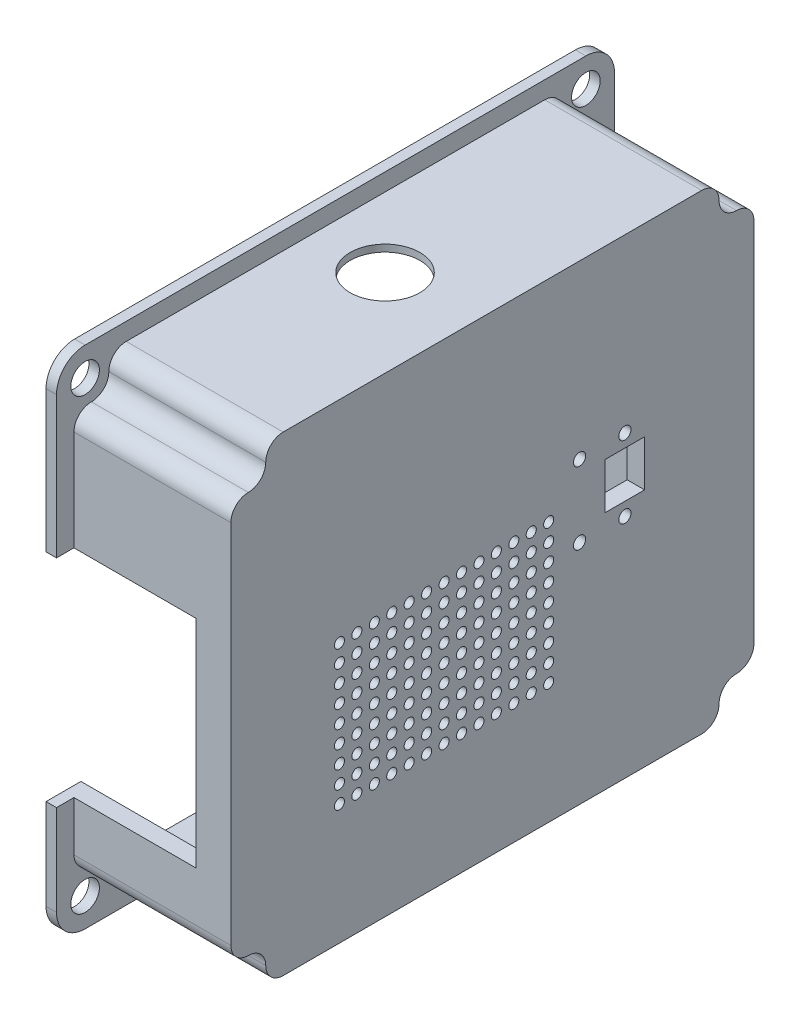
from build123d import *

# Parameters (mm, degrees)
SALIENTE_EXTRUIR1_DEPTH      = 3
SALIENTE_EXTRUIR2_DEPTH      = 40
SALIENTE_EXTRUIR2_DEPTH_BACK = 3
CROQUIS4_R                   = 4.1
CORTAR_EXTRUIR1_DEPTH        = 10
REDONDEO1_R                  = 5
CROQUIS5_R                   = 1.45
SALIENTE_EXTRUIR3_DEPTH      = 5
CORTAR_EXTRUIR2_DEPTH        = 7
CORTAR_EXTRUIR2_DEPTH_BACK   = 7
CROQUIS6_W                   = 38
CROQUIS6_H                   = 62
CORTAR_EXTRUIR3_REACH        = 170.238
CROQUIS7_R                   = 10
CROQUIS8_R                   = 14
CORTAR_EXTRUIR4_DEPTH        = 3
REDONDEO2_R                  = 2
CORTAR_EXTRUIR5_START        = -3
CROQUIS9_R                   = 14
CORTAR_EXTRUIR5_DEPTH        = 3
REDONDEO3_R                  = 2
CROQUIS10_R                  = 1.75
CROQUIS10_W                  = 13.2
CROQUIS10_H                  = 11.37393079
CORTAR_EXTRUIR6_DEPTH        = 10


with BuildPart() as part:
    # Croquis2 → Saliente-Extruir1 (new body)
    with BuildSketch(Plane.YZ):
        with BuildLine():
            Line((-64.3, 80), (64.3, 80))
            ThreePointArc((64.3, 80), (70.098275606, 77.598275606), (72.5, 71.8))
            Line((72.5, 71.8), (72.5, -71.8))
            ThreePointArc((72.5, -71.8), (70.098275606, -77.598275606), (64.3, -80))
            Line((64.3, -80), (-64.3, -80))
            ThreePointArc((-64.3, -80), (-70.098275606, -77.598275606), (-72.5, -71.8))
            Line((-72.5, -71.8), (-72.5, 71.8))
            ThreePointArc((-72.5, 71.8), (-70.098275606, 77.598275606), (-64.3, 80))
        make_face()
        Polygon((57.5, 75), (57.5, 65), (67.5, 65), (67.5, -65), (57.5, -65), (57.5, -75), (-57.5, -75), (-57.5, -65), (-67.5, -65), (-67.5, 65), (-57.5, 65), (-57.5, 75), align=None, mode=Mode.SUBTRACT)
    extrude(amount=SALIENTE_EXTRUIR1_DEPTH)

    # Croquis3 → Saliente-Extruir2 (add, two sides: drawn at the far end of the back side and taken through both)
    with BuildSketch(Plane.YZ.offset(3).offset(-SALIENTE_EXTRUIR2_DEPTH_BACK)):
        Polygon((-57.5, -65), (-57.5, -75), (57.5, -75), (57.5, -65), (67.5, -65), (67.5, 65), (57.5, 65), (57.5, 75), (-57.5, 75), (-57.5, 65), (-67.5, 65), (-67.5, -65), align=None)
        Polygon((-52.5, -60), (-52.5, -70), (52.5, -70), (52.5, -60), (62.5, -60), (62.5, 60), (52.5, 60), (52.5, 70), (-52.5, 70), (-52.5, 60), (-62.5, 60), (-62.5, -60), align=None, mode=Mode.SUBTRACT)
    extrude(amount=SALIENTE_EXTRUIR2_DEPTH + SALIENTE_EXTRUIR2_DEPTH_BACK)

    # Croquis4 → Cortar-Extruir1 (cut)
    with BuildSketch(Plane.YZ.offset(3)):
        with Locations(Location((64.3, -71.8, 0), (0, 0, 270))):
            Circle(CROQUIS4_R)
        with Locations(Location((64.3, 71.8, 0), (0, 0, 270))):
            Circle(CROQUIS4_R)
        with Locations(Location((-64.3, 71.8, 0), (0, 0, 270))):
            Circle(CROQUIS4_R)
        with Locations(Location((-64.3, -71.8, 0), (0, 0, 270))):
            Circle(CROQUIS4_R)
    extrude(amount=-CORTAR_EXTRUIR1_DEPTH, mode=Mode.SUBTRACT)

    # Redondeo1
    redondeo1_edges = [part.edges().sort_by_distance(p)[0] for p in [
        (23, 57.5, 75),
        (23, 57.5, 65),
        (23, 67.5, 65),
        (21.5, -52.5, -60),
        (21.5, -52.5, -70),
        (21.5, 52.5, -70),
        (21.5, 52.5, -60),
        (21.5, 62.5, -60),
        (21.5, -52.5, 70),
        (21.5, -52.5, 60),
        (21.5, -62.5, 60),
        (21.5, -62.5, -60),
        (23, -67.5, -65),
        (23, -67.5, 65),
        (23, -57.5, 65),
        (23, 67.5, -65),
        (23, 57.5, -65),
        (23, 57.5, -75),
        (23, -57.5, -75),
        (23, -57.5, -65),
        (23, -57.5, 75),
        (21.5, 52.5, 70),
        (21.5, 62.5, 60),
        (21.5, 52.5, 60),
    ]]
    fillet(redondeo1_edges, radius=REDONDEO1_R - 0.0001)  # a hair under: the kernel refuses the full size

    # Croquis5 → Saliente-Extruir3 (add)
    with BuildSketch(Plane.YZ.offset(43)):
        with BuildLine():
            Line((-67.5, 60), (-67.5, -60))
            ThreePointArc((-67.5, -60), (-66.035533906, -63.535533906), (-62.5, -65))
            ThreePointArc((-62.5, -65), (-58.964466094, -66.464466094), (-57.5, -70))
            ThreePointArc((-57.5, -70), (-56.035533906, -73.535533906), (-52.5, -75))
            Line((-52.5, -75), (52.5, -75))
            ThreePointArc((52.5, -75), (56.035533906, -73.535533906), (57.5, -70))
            ThreePointArc((57.5, -70), (58.964466094, -66.464466094), (62.5, -65))
            ThreePointArc((62.5, -65), (66.035533906, -63.535533906), (67.5, -60))
            Line((67.5, -60), (67.5, 60))
            ThreePointArc((67.5, 60), (66.035533906, 63.535533906), (62.5, 65))
            ThreePointArc((62.5, 65), (58.964466094, 66.464466094), (57.5, 70))
            ThreePointArc((57.5, 70), (56.035533906, 73.535533906), (52.5, 75))
            Line((52.5, 75), (-52.5, 75))
            ThreePointArc((-52.5, 75), (-56.035533906, 73.535533906), (-57.5, 70))
            ThreePointArc((-57.5, 70), (-58.964466094, 66.464466094), (-62.5, 65))
            ThreePointArc((-62.5, 65), (-66.035533906, 63.535533906), (-67.5, 60))
        make_face()
        with Locations(Location((7.073344347, -16.136194388, 0), (0, 0, 270))):
            Circle(CROQUIS5_R, mode=Mode.SUBTRACT)
        with Locations(Location((2.073344347, -16.136194388, 0), (0, 0, 270))):
            Circle(CROQUIS5_R, mode=Mode.SUBTRACT)
        with Locations(Location((-2.926655653, -16.136194388, 0), (0, 0, 270))):
            Circle(CROQUIS5_R, mode=Mode.SUBTRACT)
        with Locations(Location((-7.926655653, -16.136194388, 0), (0, 0, 270))):
            Circle(CROQUIS5_R, mode=Mode.SUBTRACT)
        with Locations(Location((-12.926655653, -16.136194388, 0), (0, 0, 270))):
            Circle(CROQUIS5_R, mode=Mode.SUBTRACT)
        with Locations(Location((-17.926655653, -16.136194388, 0), (0, 0, 270))):
            Circle(CROQUIS5_R, mode=Mode.SUBTRACT)
        with Locations(Location((-22.926655653, -16.136194388, 0), (0, 0, 270))):
            Circle(CROQUIS5_R, mode=Mode.SUBTRACT)
        with Locations(Location((-27.926655653, -16.136194388, 0), (0, 0, 270))):
            Circle(CROQUIS5_R, mode=Mode.SUBTRACT)
        with Locations(Location((-32.926655653, -16.136194388, 0), (0, 0, 270))):
            Circle(CROQUIS5_R, mode=Mode.SUBTRACT)
        with Locations(Location((2.073344347, -11.136194388, 0), (0, 0, 270))):
            Circle(CROQUIS5_R, mode=Mode.SUBTRACT)
        with Locations(Location((-2.926655653, -11.136194388, 0), (0, 0, 270))):
            Circle(CROQUIS5_R, mode=Mode.SUBTRACT)
        with Locations(Location((-7.926655653, -11.136194388, 0), (0, 0, 270))):
            Circle(CROQUIS5_R, mode=Mode.SUBTRACT)
        with Locations(Location((-12.926655653, -11.136194388, 0), (0, 0, 270))):
            Circle(CROQUIS5_R, mode=Mode.SUBTRACT)
        with Locations(Location((-17.926655653, -11.136194388, 0), (0, 0, 270))):
            Circle(CROQUIS5_R, mode=Mode.SUBTRACT)
        with Locations(Location((-22.926655653, -11.136194388, 0), (0, 0, 270))):
            Circle(CROQUIS5_R, mode=Mode.SUBTRACT)
        with Locations(Location((-27.926655653, -11.136194388, 0), (0, 0, 270))):
            Circle(CROQUIS5_R, mode=Mode.SUBTRACT)
        with Locations(Location((-32.926655653, -11.136194388, 0), (0, 0, 270))):
            Circle(CROQUIS5_R, mode=Mode.SUBTRACT)
        with Locations(Location((2.073344347, -6.136194388, 0), (0, 0, 270))):
            Circle(CROQUIS5_R, mode=Mode.SUBTRACT)
        with Locations(Location((-2.926655653, -6.136194388, 0), (0, 0, 270))):
            Circle(CROQUIS5_R, mode=Mode.SUBTRACT)
        with Locations(Location((-7.926655653, -6.136194388, 0), (0, 0, 270))):
            Circle(CROQUIS5_R, mode=Mode.SUBTRACT)
        with Locations(Location((-12.926655653, -6.136194388, 0), (0, 0, 270))):
            Circle(CROQUIS5_R, mode=Mode.SUBTRACT)
        with Locations(Location((-17.926655653, -6.136194388, 0), (0, 0, 270))):
            Circle(CROQUIS5_R, mode=Mode.SUBTRACT)
        with Locations(Location((-22.926655653, -6.136194388, 0), (0, 0, 270))):
            Circle(CROQUIS5_R, mode=Mode.SUBTRACT)
        with Locations(Location((-27.926655653, -6.136194388, 0), (0, 0, 270))):
            Circle(CROQUIS5_R, mode=Mode.SUBTRACT)
        with Locations(Location((-32.926655653, -6.136194388, 0), (0, 0, 270))):
            Circle(CROQUIS5_R, mode=Mode.SUBTRACT)
        with Locations(Location((2.073344347, -1.136194388, 0), (0, 0, 270))):
            Circle(CROQUIS5_R, mode=Mode.SUBTRACT)
        with Locations(Location((-2.926655653, -1.136194388, 0), (0, 0, 270))):
            Circle(CROQUIS5_R, mode=Mode.SUBTRACT)
        with Locations(Location((-7.926655653, -1.136194388, 0), (0, 0, 270))):
            Circle(CROQUIS5_R, mode=Mode.SUBTRACT)
        with Locations(Location((-12.926655653, -1.136194388, 0), (0, 0, 270))):
            Circle(CROQUIS5_R, mode=Mode.SUBTRACT)
        with Locations(Location((-17.926655653, -1.136194388, 0), (0, 0, 270))):
            Circle(CROQUIS5_R, mode=Mode.SUBTRACT)
        with Locations(Location((-22.926655653, -1.136194388, 0), (0, 0, 270))):
            Circle(CROQUIS5_R, mode=Mode.SUBTRACT)
        with Locations(Location((-27.926655653, -1.136194388, 0), (0, 0, 270))):
            Circle(CROQUIS5_R, mode=Mode.SUBTRACT)
        with Locations(Location((-32.926655653, -1.136194388, 0), (0, 0, 270))):
            Circle(CROQUIS5_R, mode=Mode.SUBTRACT)
        with Locations(Location((2.073344347, 3.863805612, 0), (0, 0, 270))):
            Circle(CROQUIS5_R, mode=Mode.SUBTRACT)
        with Locations(Location((-2.926655653, 3.863805612, 0), (0, 0, 270))):
            Circle(CROQUIS5_R, mode=Mode.SUBTRACT)
        with Locations(Location((-7.926655653, 3.863805612, 0), (0, 0, 270))):
            Circle(CROQUIS5_R, mode=Mode.SUBTRACT)
        with Locations(Location((-12.926655653, 3.863805612, 0), (0, 0, 270))):
            Circle(CROQUIS5_R, mode=Mode.SUBTRACT)
        with Locations(Location((-17.926655653, 3.863805612, 0), (0, 0, 270))):
            Circle(CROQUIS5_R, mode=Mode.SUBTRACT)
        with Locations(Location((-22.926655653, 3.863805612, 0), (0, 0, 270))):
            Circle(CROQUIS5_R, mode=Mode.SUBTRACT)
        with Locations(Location((-27.926655653, 3.863805612, 0), (0, 0, 270))):
            Circle(CROQUIS5_R, mode=Mode.SUBTRACT)
        with Locations(Location((-32.926655653, 3.863805612, 0), (0, 0, 270))):
            Circle(CROQUIS5_R, mode=Mode.SUBTRACT)
        with Locations(Location((2.073344347, 8.863805612, 0), (0, 0, 270))):
            Circle(CROQUIS5_R, mode=Mode.SUBTRACT)
        with Locations(Location((-2.926655653, 8.863805612, 0), (0, 0, 270))):
            Circle(CROQUIS5_R, mode=Mode.SUBTRACT)
        with Locations(Location((-7.926655653, 8.863805612, 0), (0, 0, 270))):
            Circle(CROQUIS5_R, mode=Mode.SUBTRACT)
        with Locations(Location((-12.926655653, 8.863805612, 0), (0, 0, 270))):
            Circle(CROQUIS5_R, mode=Mode.SUBTRACT)
        with Locations(Location((-17.926655653, 8.863805612, 0), (0, 0, 270))):
            Circle(CROQUIS5_R, mode=Mode.SUBTRACT)
        with Locations(Location((-22.926655653, 8.863805612, 0), (0, 0, 270))):
            Circle(CROQUIS5_R, mode=Mode.SUBTRACT)
        with Locations(Location((-27.926655653, 8.863805612, 0), (0, 0, 270))):
            Circle(CROQUIS5_R, mode=Mode.SUBTRACT)
        with Locations(Location((-32.926655653, 8.863805612, 0), (0, 0, 270))):
            Circle(CROQUIS5_R, mode=Mode.SUBTRACT)
        with Locations(Location((2.073344347, 13.863805612, 0), (0, 0, 270))):
            Circle(CROQUIS5_R, mode=Mode.SUBTRACT)
        with Locations(Location((-2.926655653, 13.863805612, 0), (0, 0, 270))):
            Circle(CROQUIS5_R, mode=Mode.SUBTRACT)
        with Locations(Location((-7.926655653, 13.863805612, 0), (0, 0, 270))):
            Circle(CROQUIS5_R, mode=Mode.SUBTRACT)
        with Locations(Location((-12.926655653, 13.863805612, 0), (0, 0, 270))):
            Circle(CROQUIS5_R, mode=Mode.SUBTRACT)
        with Locations(Location((-17.926655653, 13.863805612, 0), (0, 0, 270))):
            Circle(CROQUIS5_R, mode=Mode.SUBTRACT)
        with Locations(Location((-22.926655653, 13.863805612, 0), (0, 0, 270))):
            Circle(CROQUIS5_R, mode=Mode.SUBTRACT)
        with Locations(Location((-27.926655653, 13.863805612, 0), (0, 0, 270))):
            Circle(CROQUIS5_R, mode=Mode.SUBTRACT)
        with Locations(Location((-32.926655653, 13.863805612, 0), (0, 0, 270))):
            Circle(CROQUIS5_R, mode=Mode.SUBTRACT)
        with Locations(Location((2.073344347, 18.863805612, 0), (0, 0, 270))):
            Circle(CROQUIS5_R, mode=Mode.SUBTRACT)
        with Locations(Location((-2.926655653, 18.863805612, 0), (0, 0, 270))):
            Circle(CROQUIS5_R, mode=Mode.SUBTRACT)
        with Locations(Location((-7.926655653, 18.863805612, 0), (0, 0, 270))):
            Circle(CROQUIS5_R, mode=Mode.SUBTRACT)
        with Locations(Location((-12.926655653, 18.863805612, 0), (0, 0, 270))):
            Circle(CROQUIS5_R, mode=Mode.SUBTRACT)
        with Locations(Location((-17.926655653, 18.863805612, 0), (0, 0, 270))):
            Circle(CROQUIS5_R, mode=Mode.SUBTRACT)
        with Locations(Location((-22.926655653, 18.863805612, 0), (0, 0, 270))):
            Circle(CROQUIS5_R, mode=Mode.SUBTRACT)
        with Locations(Location((-27.926655653, 18.863805612, 0), (0, 0, 270))):
            Circle(CROQUIS5_R, mode=Mode.SUBTRACT)
        with Locations(Location((-32.926655653, 18.863805612, 0), (0, 0, 270))):
            Circle(CROQUIS5_R, mode=Mode.SUBTRACT)
        with Locations(Location((2.073344347, 23.863805612, 0), (0, 0, 270))):
            Circle(CROQUIS5_R, mode=Mode.SUBTRACT)
        with Locations(Location((-2.926655653, 23.863805612, 0), (0, 0, 270))):
            Circle(CROQUIS5_R, mode=Mode.SUBTRACT)
        with Locations(Location((-7.926655653, 23.863805612, 0), (0, 0, 270))):
            Circle(CROQUIS5_R, mode=Mode.SUBTRACT)
        with Locations(Location((-12.926655653, 23.863805612, 0), (0, 0, 270))):
            Circle(CROQUIS5_R, mode=Mode.SUBTRACT)
        with Locations(Location((-17.926655653, 23.863805612, 0), (0, 0, 270))):
            Circle(CROQUIS5_R, mode=Mode.SUBTRACT)
        with Locations(Location((-22.926655653, 23.863805612, 0), (0, 0, 270))):
            Circle(CROQUIS5_R, mode=Mode.SUBTRACT)
        with Locations(Location((-27.926655653, 23.863805612, 0), (0, 0, 270))):
            Circle(CROQUIS5_R, mode=Mode.SUBTRACT)
        with Locations(Location((-32.926655653, 23.863805612, 0), (0, 0, 270))):
            Circle(CROQUIS5_R, mode=Mode.SUBTRACT)
        with Locations(Location((2.073344347, 28.863805612, 0), (0, 0, 270))):
            Circle(CROQUIS5_R, mode=Mode.SUBTRACT)
        with Locations(Location((-2.926655653, 28.863805612, 0), (0, 0, 270))):
            Circle(CROQUIS5_R, mode=Mode.SUBTRACT)
        with Locations(Location((-7.926655653, 28.863805612, 0), (0, 0, 270))):
            Circle(CROQUIS5_R, mode=Mode.SUBTRACT)
        with Locations(Location((-12.926655653, 28.863805612, 0), (0, 0, 270))):
            Circle(CROQUIS5_R, mode=Mode.SUBTRACT)
        with Locations(Location((-17.926655653, 28.863805612, 0), (0, 0, 270))):
            Circle(CROQUIS5_R, mode=Mode.SUBTRACT)
        with Locations(Location((-22.926655653, 28.863805612, 0), (0, 0, 270))):
            Circle(CROQUIS5_R, mode=Mode.SUBTRACT)
        with Locations(Location((-27.926655653, 28.863805612, 0), (0, 0, 270))):
            Circle(CROQUIS5_R, mode=Mode.SUBTRACT)
        with Locations(Location((-32.926655653, 28.863805612, 0), (0, 0, 270))):
            Circle(CROQUIS5_R, mode=Mode.SUBTRACT)
        with Locations(Location((2.073344347, 33.863805612, 0), (0, 0, 270))):
            Circle(CROQUIS5_R, mode=Mode.SUBTRACT)
        with Locations(Location((-2.926655653, 33.863805612, 0), (0, 0, 270))):
            Circle(CROQUIS5_R, mode=Mode.SUBTRACT)
        with Locations(Location((-7.926655653, 33.863805612, 0), (0, 0, 270))):
            Circle(CROQUIS5_R, mode=Mode.SUBTRACT)
        with Locations(Location((-12.926655653, 33.863805612, 0), (0, 0, 270))):
            Circle(CROQUIS5_R, mode=Mode.SUBTRACT)
        with Locations(Location((-17.926655653, 33.863805612, 0), (0, 0, 270))):
            Circle(CROQUIS5_R, mode=Mode.SUBTRACT)
        with Locations(Location((-22.926655653, 33.863805612, 0), (0, 0, 270))):
            Circle(CROQUIS5_R, mode=Mode.SUBTRACT)
        with Locations(Location((-27.926655653, 33.863805612, 0), (0, 0, 270))):
            Circle(CROQUIS5_R, mode=Mode.SUBTRACT)
        with Locations(Location((-32.926655653, 33.863805612, 0), (0, 0, 270))):
            Circle(CROQUIS5_R, mode=Mode.SUBTRACT)
        with Locations(Location((2.073344347, 38.863805612, 0), (0, 0, 270))):
            Circle(CROQUIS5_R, mode=Mode.SUBTRACT)
        with Locations(Location((-2.926655653, 38.863805612, 0), (0, 0, 270))):
            Circle(CROQUIS5_R, mode=Mode.SUBTRACT)
        with Locations(Location((-7.926655653, 38.863805612, 0), (0, 0, 270))):
            Circle(CROQUIS5_R, mode=Mode.SUBTRACT)
        with Locations(Location((-12.926655653, 38.863805612, 0), (0, 0, 270))):
            Circle(CROQUIS5_R, mode=Mode.SUBTRACT)
        with Locations(Location((-17.926655653, 38.863805612, 0), (0, 0, 270))):
            Circle(CROQUIS5_R, mode=Mode.SUBTRACT)
        with Locations(Location((-22.926655653, 38.863805612, 0), (0, 0, 270))):
            Circle(CROQUIS5_R, mode=Mode.SUBTRACT)
        with Locations(Location((-27.926655653, 38.863805612, 0), (0, 0, 270))):
            Circle(CROQUIS5_R, mode=Mode.SUBTRACT)
        with Locations(Location((-32.926655653, 38.863805612, 0), (0, 0, 270))):
            Circle(CROQUIS5_R, mode=Mode.SUBTRACT)
        with Locations(Location((2.073344347, 43.863805612, 0), (0, 0, 270))):
            Circle(CROQUIS5_R, mode=Mode.SUBTRACT)
        with Locations(Location((-2.926655653, 43.863805612, 0), (0, 0, 270))):
            Circle(CROQUIS5_R, mode=Mode.SUBTRACT)
        with Locations(Location((-7.926655653, 43.863805612, 0), (0, 0, 270))):
            Circle(CROQUIS5_R, mode=Mode.SUBTRACT)
        with Locations(Location((-12.926655653, 43.863805612, 0), (0, 0, 270))):
            Circle(CROQUIS5_R, mode=Mode.SUBTRACT)
        with Locations(Location((-17.926655653, 43.863805612, 0), (0, 0, 270))):
            Circle(CROQUIS5_R, mode=Mode.SUBTRACT)
        with Locations(Location((-22.926655653, 43.863805612, 0), (0, 0, 270))):
            Circle(CROQUIS5_R, mode=Mode.SUBTRACT)
        with Locations(Location((-27.926655653, 43.863805612, 0), (0, 0, 270))):
            Circle(CROQUIS5_R, mode=Mode.SUBTRACT)
        with Locations(Location((-32.926655653, 43.863805612, 0), (0, 0, 270))):
            Circle(CROQUIS5_R, mode=Mode.SUBTRACT)
        with Locations(Location((7.073344347, -11.136194388, 0), (0, 0, 270))):
            Circle(CROQUIS5_R, mode=Mode.SUBTRACT)
        with Locations(Location((7.073344347, -6.136194388, 0), (0, 0, 270))):
            Circle(CROQUIS5_R, mode=Mode.SUBTRACT)
        with Locations(Location((7.073344347, -1.136194388, 0), (0, 0, 270))):
            Circle(CROQUIS5_R, mode=Mode.SUBTRACT)
        with Locations(Location((7.073344347, 3.863805612, 0), (0, 0, 270))):
            Circle(CROQUIS5_R, mode=Mode.SUBTRACT)
        with Locations(Location((7.073344347, 8.863805612, 0), (0, 0, 270))):
            Circle(CROQUIS5_R, mode=Mode.SUBTRACT)
        with Locations(Location((7.073344347, 13.863805612, 0), (0, 0, 270))):
            Circle(CROQUIS5_R, mode=Mode.SUBTRACT)
        with Locations(Location((7.073344347, 18.863805612, 0), (0, 0, 270))):
            Circle(CROQUIS5_R, mode=Mode.SUBTRACT)
        with Locations(Location((7.073344347, 23.863805612, 0), (0, 0, 270))):
            Circle(CROQUIS5_R, mode=Mode.SUBTRACT)
        with Locations(Location((7.073344347, 28.863805612, 0), (0, 0, 270))):
            Circle(CROQUIS5_R, mode=Mode.SUBTRACT)
        with Locations(Location((7.073344347, 33.863805612, 0), (0, 0, 270))):
            Circle(CROQUIS5_R, mode=Mode.SUBTRACT)
        with Locations(Location((7.073344347, 38.863805612, 0), (0, 0, 270))):
            Circle(CROQUIS5_R, mode=Mode.SUBTRACT)
        with Locations(Location((7.073344347, 43.863805612, 0), (0, 0, 270))):
            Circle(CROQUIS5_R, mode=Mode.SUBTRACT)
    extrude(amount=SALIENTE_EXTRUIR3_DEPTH)

    # Croquis6 → Cortar-Extruir2 (cut, two sides: drawn at the far end of the back side and taken through both)
    with BuildSketch(Plane.XY.offset(75).offset(-CORTAR_EXTRUIR2_DEPTH_BACK)):
        with Locations((19, -7.269565274)):
            Rectangle(CROQUIS6_W, CROQUIS6_H)
    extrude(amount=CORTAR_EXTRUIR2_DEPTH + CORTAR_EXTRUIR2_DEPTH_BACK, mode=Mode.SUBTRACT)

    # Cortar-Extruir3: up to this face of the body (flat: up to its plane)
    cortar_extruir3_end = Plane(part.part.faces().sort_by_distance((25.499996296, -67.5, 0))[0])
    # Croquis7 → Cortar-Extruir3 (cut, up to the picked face)
    with BuildSketch(Plane(origin=(0, 67.5, 0), x_dir=(-1, 0, 0), z_dir=(0, 1, 0)), mode=Mode.PRIVATE) as cortar_extruir3_sk1:
        with Locations(Location((-23, 5.796340117, 0), (0, 0, 270))):
            Circle(CROQUIS7_R)
    cortar_extruir3_tool1 = split(extrude(cortar_extruir3_sk1.sketch, amount=-CORTAR_EXTRUIR3_REACH, mode=Mode.PRIVATE), bisect_by=cortar_extruir3_end, keep=Keep.BOTH, mode=Mode.PRIVATE)
    add(cortar_extruir3_tool1.solids().sort_by(Axis((23, 67.5, 5.79634), (0, -1, 0)))[0], mode=Mode.SUBTRACT)

    # Croquis8 → Cortar-Extruir4 (cut)
    with BuildSketch(Plane.XZ.offset(-62.5)):
        with Locations(Location((23, 5.796340117, 0), (0, 0, 270))):
            Circle(CROQUIS8_R)
    extrude(amount=-CORTAR_EXTRUIR4_DEPTH, mode=Mode.SUBTRACT)

    # Redondeo2
    redondeo2_edges = [part.edges().sort_by_distance(p)[0] for p in [
        (23, 62.5, 19.796340117),
    ]]
    fillet(redondeo2_edges, radius=REDONDEO2_R)

    # Croquis9 → Cortar-Extruir5 (cut)
    with BuildSketch(Plane(origin=(0, -62.5, 0), x_dir=(-1, 0, 0), z_dir=(0, 1, 0)).offset(CORTAR_EXTRUIR5_START)):
        with Locations(Location((-23, 5.796340117, 0), (0, 0, 270))):
            Circle(CROQUIS9_R)
    extrude(amount=CORTAR_EXTRUIR5_DEPTH, mode=Mode.SUBTRACT)

    # Redondeo3
    redondeo3_edges = [part.edges().sort_by_distance(p)[0] for p in [
        (23, -62.5, 19.796340117),
    ]]
    fillet(redondeo3_edges, radius=REDONDEO3_R)

    # Croquis10 → Cortar-Extruir6 (cut)
    with BuildSketch(Plane.YZ.offset(48)):
        with Locations(Location((18.267598054, -24.986454459, 0), (0, 0, 270))):
            Circle(CROQUIS10_R)
        with Locations(Location((-2.432401946, -24.986454459, 0), (0, 0, 270))):
            Circle(CROQUIS10_R)
        with Locations(Location((-2.432401946, -37.986454459, 0), (0, 0, 270))):
            Circle(CROQUIS10_R)
        with Locations(Location((18.267598054, -37.986454459, 0), (0, 0, 270))):
            Circle(CROQUIS10_R)
        with Locations((7.917598054, -37.949489064)):
            Rectangle(CROQUIS10_W, CROQUIS10_H)
    extrude(amount=-CORTAR_EXTRUIR6_DEPTH, mode=Mode.SUBTRACT)


solid = part.part
